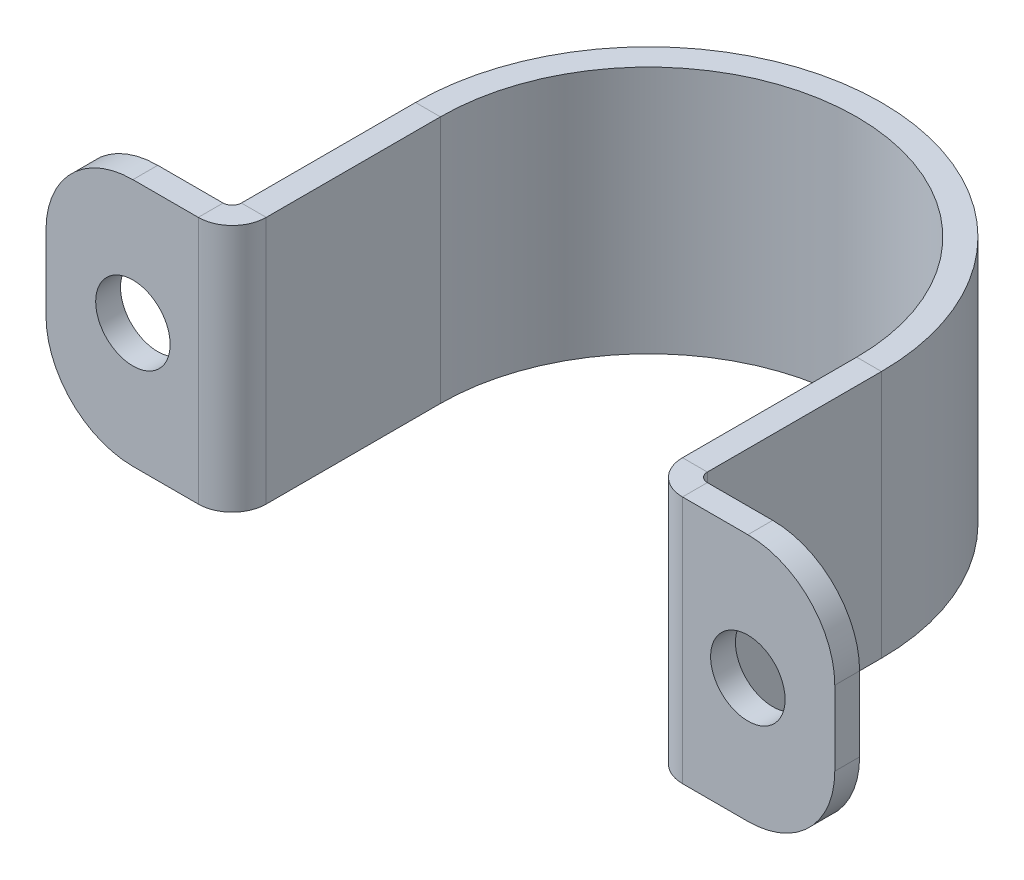
from build123d import *

# Parameters (mm, degrees)
BASE_FLANGE2_DEPTH = 20
FILLET1_R          = 7
SKETCH17_R         = 3
CUT_EXTRUDE1_DEPTH = 51.329697794


# Sheet-metal steps are written as plain solids
with BuildPart() as part:
    # Sketch12 → Base-Flange2 (new body)
    with BuildSketch(Plane(origin=(0, 0, 0), x_dir=(1, 0, 0), z_dir=(0, 1, 0))):
        with BuildLine():
            Line((-31.764, 0), (-19.5006, 0))
            ThreePointArc((-19.5006, 0), (-17.565531583, 0.801531583), (-16.764, 2.7366))
            Line((-16.764, 2.7366), (-16.764, 16.764))
            ThreePointArc((-16.764, 16.764), (0, 33.528), (16.764, 16.764))
            Line((16.764, 16.764), (16.764, 2.7366))
            ThreePointArc((16.764, 2.7366), (17.565531583, 0.801531583), (19.5006, 0))
            Line((19.5006, 0), (31.764, 0))
            Line((31.764, 0), (31.764, 2))
            Line((31.764, 2), (19.5006, 2))
            ThreePointArc((19.5006, 2), (18.979745145, 2.215745145), (18.764, 2.7366))
            Line((18.764, 2.7366), (18.764, 16.764))
            ThreePointArc((18.764, 16.764), (0, 35.528), (-18.764, 16.764))
            Line((-18.764, 16.764), (-18.764, 2.7366))
            ThreePointArc((-18.764, 2.7366), (-18.979745145, 2.215745145), (-19.5006, 2))
            Line((-19.5006, 2), (-31.764, 2))
            Line((-31.764, 2), (-31.764, 0))
        make_face()
    extrude(amount=BASE_FLANGE2_DEPTH)

    # Fillet1
    fillet1_edges = [part.edges().sort_by_distance(p)[0] for p in [
        (-31.764, 0, -1),
        (31.764, 0, -1),
        (-31.764, 20, -1),
        (31.764, 20, -1),
    ]]
    fillet(fillet1_edges, radius=FILLET1_R)

    # Sketch17 → Cut-Extrude1 (cut, through all)
    with BuildSketch(Plane(origin=(0, 0, -2), x_dir=(-1, 0, 0), z_dir=(0, 0, -1))):
        with Locations((24.764, 10)):
            Circle(SKETCH17_R)
    cut_extrude1 = extrude(amount=-CUT_EXTRUDE1_DEPTH, mode=Mode.SUBTRACT)

    # Mirror1: Cut-Extrude1 across plane
    add(cut_extrude1.mirror(Plane(origin=(0, 0, 0), x_dir=(0, 0, 1), z_dir=(1, 0, 0))), mode=Mode.SUBTRACT)


solid = part.part
